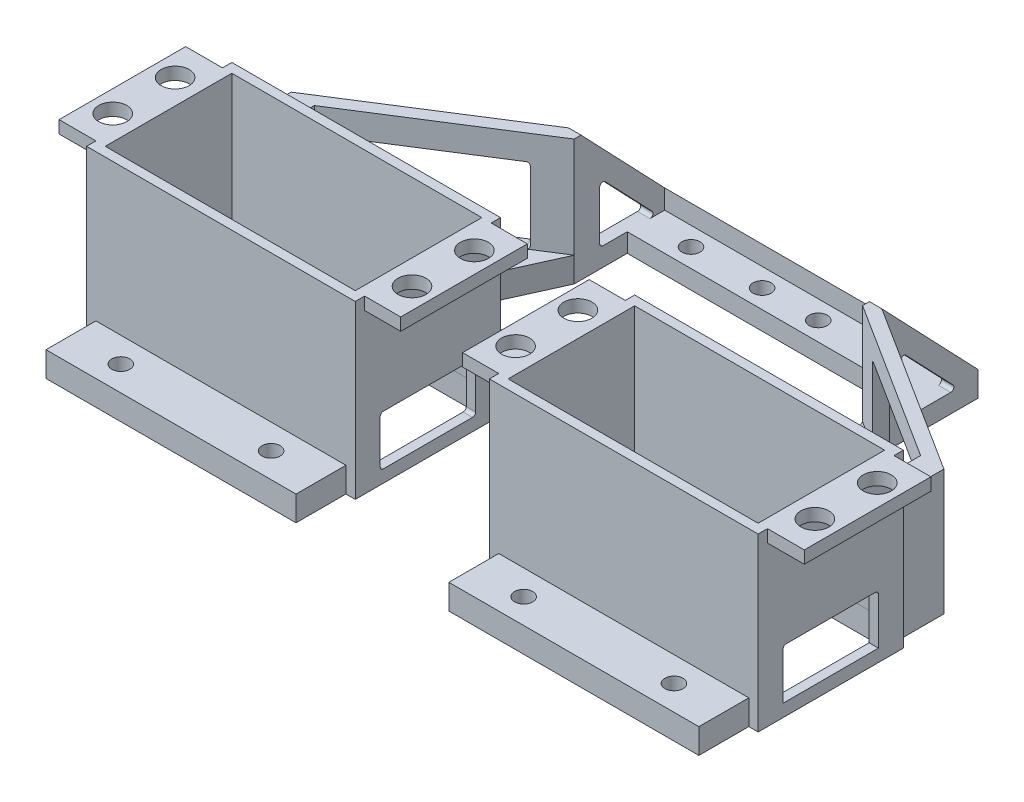
from build123d import *

# Parameters (mm, degrees)
BOSS_EXTRUDE1_DEPTH = 4
SKETCH2_W           = 40.102425689505765
SKETCH2_H           = 20.295207656431337
BOSS_EXTRUDE3_DEPTH = 23.5
SKETCH4_R           = 2.249999999999988
SKETCH4_R_2         = 2.2500000000000173
SKETCH4_R_3         = 2.250000000000014
SKETCH4_R_4         = 2.2500000000000044
BOSS_EXTRUDE4_DEPTH = 2
SKETCH5_W           = 15.299999999999997
SKETCH5_H           = 8
CUT_EXTRUDE1_DEPTH  = 68.76582277891666
SKETCH6_R           = 1.45
CUT_EXTRUDE2_DEPTH  = 75.55058334975256
CUT_EXTRUDE3_DEPTH  = 59.2234885463673
CUT_EXTRUDE4_DEPTH  = 2
BOSS_EXTRUDE5_DEPTH = 4
BOSS_EXTRUDE6_DEPTH = 4
SKETCH11_R          = 1.45
CUT_EXTRUDE5_DEPTH  = 75.87182031838415
CUT_EXTRUDE6_DEPTH  = 2
FILLET1_START       = -32.422486888
FILLET1_DEPTH       = 2
FILLET2_R           = 0.5
FILLET3_R           = 0.5
CUT_EXTRUDE7_REACH  = 104.413
FILLET4_R           = 0.5
CUT_EXTRUDE8_DEPTH  = 1


with BuildPart() as part:
    # Sketch1 → Boss-Extrude1 (new body)
    # profile 1 of 4: a face of its own
    with BuildSketch(Plane(origin=(0, 0, 0), x_dir=(1, 0, 0), z_dir=(0, 1, 0))):
        Polygon((-25.126148118506794, 22.454322627102535), (-52.35237198436435, 5.174322627102537), (-48.620086317051516, 5.174322627102537), (-23.1261481185068, 21.35487172716691), (-23.1261481185068, 35.86999999999997), (4.3e-16, 35.86999999999997), (-1.391e-14, 37.87), (-25.1261481185068, 37.869999999999976), align=None)
    # profile 2 of 4: a face of its own
    with BuildSketch(Plane(origin=(0, 0, 0), x_dir=(1, 0, 0), z_dir=(0, 1, 0))):
        Polygon((-52.35237198436435, 5.174322627102537), (-52.35237198436435, -2.82088517428838), (-12.252372270713046, -2.8256773728974633), (-12.252372270713062, 5.174322627102537), (-48.620086317051516, 5.174322627102537), align=None)
    # profile 3 of 4: a face of its own
    with BuildSketch(Plane(origin=(0, 0, 0), x_dir=(1, 0, 0), z_dir=(0, 1, 0))):
        Polygon((-53.854977208807114, -26.120705770029215), (-53.852192714353464, -2.8207059364113856), (-10.75219302212477, -2.825856653619653), (-10.754977516578425, -26.125856487237474), align=None)
        Polygon((-12.25237227071306, -4.325677383608763), (-12.254798246567535, -24.625677238649185), (-52.354797960218825, -24.6208850400401), (-52.35237198436435, -4.320885184999678), align=None, mode=Mode.SUBTRACT)
    # profile 4 of 4: a face of its own
    with BuildSketch(Plane(origin=(0, 0, 0), x_dir=(1, 0, 0), z_dir=(0, 1, 0))):
        Polygon((-12.254798246567535, -26.125677249360482), (-52.35479796021883, -26.120885050751404), (-52.354797960218825, -34.12567724936048), (-12.254798246567539, -34.125677249360486), align=None)
    boss_extrude1 = extrude(amount=BOSS_EXTRUDE1_DEPTH)

    # Sketch2 → Boss-Extrude3 (add)
    with BuildSketch(Plane(origin=(0, 4, 0), x_dir=(1, 0, 0), z_dir=(0, 1, 0))):
        Polygon((-48.6200863170515, -2.8213312055679616), (-48.6200863170515, 5.174322627102537), (-23.1261481185068, 21.35487172716691), (-23.1261481185068, 35.86999999999997), (0, 35.86999999999997), (-1.391e-14, 37.87), (-25.1261481185068, 37.869999999999976), (-25.126148118506794, 22.454322627102535), (-52.35237198436435, 5.174322627102537), (-52.352371984364375, -2.82088517428838), (-53.852192714353464, -2.820705936411386), (-53.854977208807114, -26.12070577002921), (-10.754977516578425, -26.125856487237478), (-10.75219302212477, -2.8258566536196534), align=None)
        with Locations((-32.30358511546594, -14.473281211824432)):
            Rectangle(SKETCH2_W, SKETCH2_H, mode=Mode.SUBTRACT)
    boss_extrude3 = extrude(amount=BOSS_EXTRUDE3_DEPTH)

    # Sketch4 → Boss-Extrude4 (add)
    # profile 1 of 2: a face of its own
    with BuildSketch(Plane(origin=(0, 27.5, 0), x_dir=(1, 0, 0), z_dir=(0, 1, 0))):
        Polygon((-52.354797960218825, -4.325677383608763), (-59.758787012072766, -4.3200000724797905), (-59.761212987927244, -24.61999992752021), (-52.354797960218825, -24.6208850400401), align=None)
        with Locations(Location((-56.30298741308659, -9.470413098735477, 0), (0, 0, 270))):
            Circle(SKETCH4_R, mode=Mode.SUBTRACT)
        with Locations(Location((-56.30418247508382, -19.470413027326828, 0), (0, 0, 270))):
            Circle(SKETCH4_R_2, mode=Mode.SUBTRACT)
    # profile 2 of 2: a face of its own
    with BuildSketch(Plane(origin=(0, 27.5, 0), x_dir=(1, 0, 0), z_dir=(0, 1, 0))):
        Polygon((-12.25237227071306, -4.325677383608763), (-4.958787403392128, -4.326549012224863), (-4.961213379246598, -24.626548867265285), (-12.25237227071306, -24.620885040040104), align=None)
        with Locations(Location((-8.302987755848147, -9.476149396322235, 0), (0, 0, 270))):
            Circle(SKETCH4_R_3, mode=Mode.SUBTRACT)
        with Locations(Location((-8.304182817845378, -19.476149324913575, 0), (0, 0, 270))):
            Circle(SKETCH4_R_4, mode=Mode.SUBTRACT)
    boss_extrude4 = extrude(amount=-BOSS_EXTRUDE4_DEPTH)

    # Sketch5 → Cut-Extrude1 (cut, through all)
    with BuildSketch(Plane(origin=(-10.751855161177602, 0, -0.00128491335951046), x_dir=(0.00011950619972778136, 0, -0.9999999928591341), z_dir=(0.9999999928591342, 0, 0.00011950619972778137))):
        with Locations((-14.477141587167402, 6)):
            Rectangle(SKETCH5_W, SKETCH5_H)
    cut_extrude1 = extrude(amount=-CUT_EXTRUDE1_DEPTH, mode=Mode.SUBTRACT)

    # Sketch6 → Cut-Extrude2 (cut, through all)
    with BuildSketch(Plane(origin=(0, 4, 0), x_dir=(1, 0, 0), z_dir=(0, 1, 0))):
        with Locations(Location((-44.354797960218825, -30.125677249360475, 0), (0, 0, 270))):
            Circle(SKETCH6_R)
        with Locations(Location((-20.254798246567535, -30.125677249360475, 0), (0, 0, 270))):
            Circle(SKETCH6_R)
        with Locations(Location((-44.35237198436435, 1.1743226271025364, 0), (0, 0, 270))):
            Circle(SKETCH6_R)
        with Locations(Location((-20.25237227071306, 1.1743226271025369, 0), (0, 0, 270))):
            Circle(SKETCH6_R)
    cut_extrude2 = extrude(amount=-CUT_EXTRUDE2_DEPTH, mode=Mode.SUBTRACT)

    # Sketch7 → Cut-Extrude3 (cut, symmetric)
    with BuildSketch(Plane.ZY.offset(25.126148118506784)):
        Polygon((-22.454322627102542, 20.131408171948806), (2.820705936411376, 20.131408171948806), (2.820705936411375, 27.5), (-37.86999999999999, 27.5), (-37.86999999999999, 4), align=None)
    cut_extrude3 = extrude(amount=CUT_EXTRUDE3_DEPTH, both=True, mode=Mode.SUBTRACT)

    # Sketch8 → Cut-Extrude4 (cut)
    with BuildSketch(Plane.ZY.offset(25.126148118506784)):
        Polygon((-25.454322627102542, 12.649873811891633), (-34.67604337135684, 2.999999999999997), (-25.454322627102545, 3), align=None)
    cut_extrude4 = extrude(amount=-CUT_EXTRUDE4_DEPTH, mode=Mode.SUBTRACT)

    # Sketch9 → Boss-Extrude5 (add)
    with BuildSketch(Plane.XZ):
        Polygon((4.3e-16, -35.86999999999997), (0, -29.869999999999973), (-23.1261481185068, -29.869999999999976), (-23.1261481185068, -35.86999999999997), align=None)
    boss_extrude5 = extrude(amount=-BOSS_EXTRUDE5_DEPTH)

    # Sketch10 → Boss-Extrude6 (add)
    with BuildSketch(Plane(origin=(0, 4, 0), x_dir=(1, 0, 0), z_dir=(0, 1, 0))):
        Polygon((-30.43622929388228, 5.174322627102542), (-48.6200863170515, 5.174322627102537), (-23.1261481185068, 21.354871727166902), align=None)
    boss_extrude6 = extrude(amount=-BOSS_EXTRUDE6_DEPTH)

    # Sketch11 → Cut-Extrude5 (cut, symmetric)
    with BuildSketch(Plane(origin=(0, 3.0000000000000084, -9.9e-16), x_dir=(1, 0, 0), z_dir=(0, 1, 8e-17))):
        with Locations(Location((-15.904887710248492, 32.869999999999976, 0), (0, 0, 270))):
            Circle(SKETCH11_R)
        with Locations(Location((-4.5, 32.869999999999976, 0), (0, 0, 270))):
            Circle(SKETCH11_R)
    cut_extrude5 = extrude(amount=CUT_EXTRUDE5_DEPTH, both=True, mode=Mode.SUBTRACT)

    # Mirror1: Boss-Extrude1, Boss-Extrude3, Boss-Extrude4, Cut-Extrude1, Cut-Extrude2, Cut-Extrude3, Cut-Extrude4, Boss-Extrude5, Boss-Extrude6, Cut-Extrude5 across plane
    add(boss_extrude1.mirror(Plane(origin=(0, 0, 0), x_dir=(0, 0, 1), z_dir=(1, 0, 0))))
    add(boss_extrude3.mirror(Plane(origin=(0, 0, 0), x_dir=(0, 0, 1), z_dir=(1, 0, 0))))
    add(boss_extrude4.mirror(Plane(origin=(0, 0, 0), x_dir=(0, 0, 1), z_dir=(1, 0, 0))))
    add(cut_extrude1.mirror(Plane(origin=(0, 0, 0), x_dir=(0, 0, 1), z_dir=(1, 0, 0))), mode=Mode.SUBTRACT)
    add(cut_extrude2.mirror(Plane(origin=(0, 0, 0), x_dir=(0, 0, 1), z_dir=(1, 0, 0))), mode=Mode.SUBTRACT)
    add(cut_extrude3.mirror(Plane(origin=(0, 0, 0), x_dir=(0, 0, 1), z_dir=(1, 0, 0))), mode=Mode.SUBTRACT)
    add(cut_extrude4.mirror(Plane(origin=(0, 0, 0), x_dir=(0, 0, 1), z_dir=(1, 0, 0))), mode=Mode.SUBTRACT)
    add(boss_extrude5.mirror(Plane(origin=(0, 0, 0), x_dir=(0, 0, 1), z_dir=(1, 0, 0))))
    add(boss_extrude6.mirror(Plane(origin=(0, 0, 0), x_dir=(0, 0, 1), z_dir=(1, 0, 0))))
    add(cut_extrude5.mirror(Plane(origin=(0, 0, 0), x_dir=(0, 0, 1), z_dir=(1, 0, 0))), mode=Mode.SUBTRACT)

    # Sketch12 → Cut-Extrude6 (cut)
    with BuildSketch(Plane(origin=(-17.374064998482325, 0, -27.374431892861114), x_dir=(-0.8443038927608045, 0, 0.5358646626424923), z_dir=(-0.5358646626424922, 0, -0.8443038927608044))):
        Polygon((37.42857481268483, 16.131408171948806), (13.181626647101908, 16.131408171948806), (13.181626647101904, 4), (37.42857481268483, 4), align=None)
    extrude(amount=-CUT_EXTRUDE6_DEPTH, mode=Mode.SUBTRACT)

    # Fillet1: read off the stored shape, not the designer's step
    # Fillet1 outline → Fillet1 (add)
    with BuildSketch(Plane(origin=(0, 0, 0), x_dir=(0.8443038927608046, 0, -0.5358646626424919), z_dir=(0.5358646626424919, 0, 0.8443038927608048)).offset(FILLET1_START)):
        with BuildLine():
            Line((-13.181626647, 4), (-13.181626647, 4.5))
            ThreePointArc((-13.181626647, 4.5), (-13.328073256, 4.146446609), (-13.681626647, 4))
            Line((-13.681626647, 4), (-13.181626647, 4))
        make_face()
        with BuildLine():
            ThreePointArc((-13.681626647, 16.131408172), (-13.328073256, 15.984961563), (-13.181626647, 15.631408172))
            Line((-13.181626647, 15.631408172), (-13.181626647, 16.131408172))
            Line((-13.181626647, 16.131408172), (-13.681626647, 16.131408172))
        make_face()
        with BuildLine():
            Line((-37.428574813, 4), (-36.928574813, 4))
            ThreePointArc((-36.928574813, 4), (-37.282128204, 4.146446609), (-37.428574813, 4.5))
            Line((-37.428574813, 4.5), (-37.428574813, 4))
        make_face()
        with BuildLine():
            ThreePointArc((-37.428574813, 15.631408172), (-37.282128204, 15.984961563), (-36.928574813, 16.131408172))
            Line((-36.928574813, 16.131408172), (-37.428574813, 16.131408172))
            Line((-37.428574813, 16.131408172), (-37.428574813, 15.631408172))
        make_face()
    extrude(amount=FILLET1_DEPTH)

    # Fillet2
    fillet2_edges = [part.edges().sort_by_distance(p)[0] for p in [
        (-24.126148118506784, 2.999999999999997, -34.676043371356826),
        (-24.126148118506784, 3, -25.454322627102535),
        (-24.126148118506784, 12.649873811891633, -25.45432262710253),
    ]]
    fillet(fillet2_edges, radius=FILLET2_R)

    # Fillet3
    fillet3_edges = [part.edges().sort_by_distance(p)[0] for p in [
        (-11.502671041568034, 2, 6.825766995406395),
        (-53.102670744508, 2, 6.82079553749772),
        (-11.50449948642387, 2, 22.125766886151148),
        (-53.104499189363835, 2, 22.120795428242474),
        (-53.104648572113504, 10, 22.120795410390308),
        (-11.502521658818374, 10, 6.8257670132585595),
        (-53.10373434968559, 10, 6.820795410390305),
        (-11.503435881246292, 10, 22.12576701325856),
    ]]
    fillet(fillet3_edges, radius=FILLET3_R)

    # Sketch13 → Cut-Extrude7 (cut, up to next)
    with BuildSketch(Plane(origin=(17.374064998482325, 0, -27.374431892861114), x_dir=(-0.8443038927608045, 0, -0.5358646626424923), z_dir=(0.5358646626424922, 0, -0.8443038927608044)), mode=Mode.PRIVATE) as cut_extrude7_sk1:
        Polygon((-13.1816266471019, 4), (-13.181626647101892, 16.131408171948806), (-37.42857481268483, 16.131408171948806), (-37.42857481268482, 4), align=None)
    cut_extrude7_tool1 = extrude(cut_extrude7_sk1.sketch, amount=-CUT_EXTRUDE7_REACH, mode=Mode.PRIVATE) & part.part
    add(cut_extrude7_tool1.solids().sort_by_distance((38.73926, 10.065704, -13.814323))[0], mode=Mode.SUBTRACT)

    # Fillet4
    fillet4_edges = [part.edges().sort_by_distance(p)[0] for p in [
        (53.10464857211352, 10, 22.120795410390308),
        (52.35464857746916, 4, 22.120885040040104),
        (52.35373435504125, 4, 6.820885040040102),
        (53.103734349685595, 10, 6.820795410390305),
        (11.502521658818374, 10, 6.8257670132585595),
        (12.253435875890636, 4, 22.125677383608767),
        (11.503435881246292, 10, 22.12576701325856),
        (12.252521653462718, 4, 6.825677383608765),
        (24.126148118506784, 3, -25.454322627102535),
        (24.126148118506784, 12.649873811891633, -25.45432262710253),
        (24.126148118506784, 2.999999999999997, -34.676043371356826),
        (27.96749902690752, 4, -19.46656008377176),
        (48.43929175067863, 4, -6.473477384911683),
        (48.43929175067864, 16.131408171948806, -6.473477384911679),
        (27.96749902690751, 16.131408171948806, -19.46656008377177),
    ]]
    fillet(fillet4_edges, radius=FILLET4_R)

    # Sketch14 → Cut-Extrude8 (cut)
    with BuildSketch(Plane(origin=(0, 4, 0), x_dir=(1, 0, 0), z_dir=(0, 1, 0))):
        Polygon((23.1261481185068, 35.86999999999997), (-23.1261481185068, 35.86999999999997), (-23.1261481185068, 33.72041214508211), (-23.1261481185068, 29.869999999999976), (23.1261481185068, 29.869999999999976), (23.1261481185068, 33.72041214508211), align=None)
    extrude(amount=-CUT_EXTRUDE8_DEPTH, mode=Mode.SUBTRACT)


solid = part.part
